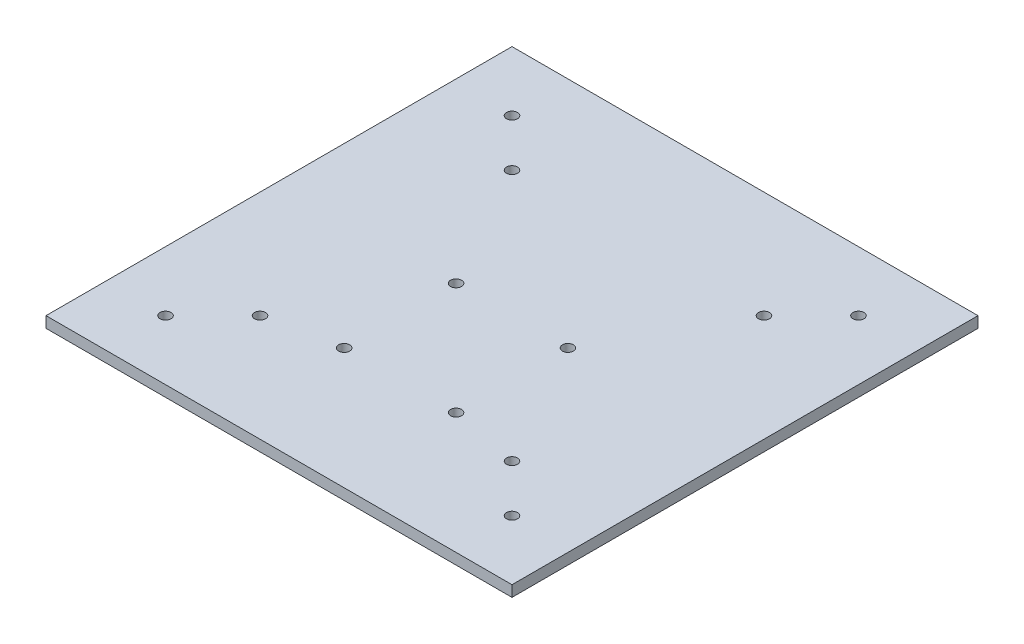
from build123d import *

# Parameters (mm, degrees)
SKETCH2_W               = 127
SKETCH2_H               = 127
BOSS_EXTRUDE1_DEPTH     = 3
CUT_EXTRUDE1_DEPTH      = 90.852657167
CUT_EXTRUDE1_DEPTH_BACK = 90.852657167
SKETCH3_R               = 1.5
SKETCH4_R               = 1.5
CUT_EXTRUDE2_DEPTH      = 10


with BuildPart() as part:
    # Sketch2 → Boss-Extrude1 (new body)
    with BuildSketch(Plane(origin=(0, 0, 0), x_dir=(1, 0, 0), z_dir=(0, 1, 0))):
        Rectangle(SKETCH2_W, SKETCH2_H)
    extrude(amount=BOSS_EXTRUDE1_DEPTH)

    # Sketch3 → Cut-Extrude1 (cut, two sides: drawn at the far end of the back side and taken through both)
    with BuildSketch(Plane(origin=(0, 3, 0), x_dir=(1, 0, 0), z_dir=(0, 1, 0)).offset(-CUT_EXTRUDE1_DEPTH_BACK)):
        with Locations((-47.214690182, 47.214690182)):
            Circle(SKETCH3_R)
        with Locations((-34.337144063, 34.337144063)):
            Circle(SKETCH3_R)
        with Locations((47.214690182, 47.214690182)):
            Circle(SKETCH3_R)
        with Locations((34.337144063, 34.337144063)):
            Circle(SKETCH3_R)
        with Locations((47.214690182, -47.214690182)):
            Circle(SKETCH3_R)
        with Locations((34.337144063, -34.337144063)):
            Circle(SKETCH3_R)
        with Locations((-47.214690182, -47.214690182)):
            Circle(SKETCH3_R)
        with Locations((-34.337144063, -34.337144063)):
            Circle(SKETCH3_R)
    extrude(amount=CUT_EXTRUDE1_DEPTH + CUT_EXTRUDE1_DEPTH_BACK, mode=Mode.SUBTRACT)

    # Sketch4 → Cut-Extrude2 (cut)
    with BuildSketch(Plane(origin=(0, 3, 0), x_dir=(1, 0, 0), z_dir=(0, 1, 0))):
        with Locations((-15.25, 0)):
            Circle(SKETCH4_R)
        with Locations((15.25, 0)):
            Circle(SKETCH4_R)
        with Locations((-15.25, -30.5)):
            Circle(SKETCH4_R)
        with Locations((15.25, -30.5)):
            Circle(SKETCH4_R)
    extrude(amount=-CUT_EXTRUDE2_DEPTH, mode=Mode.SUBTRACT)


solid = part.part
